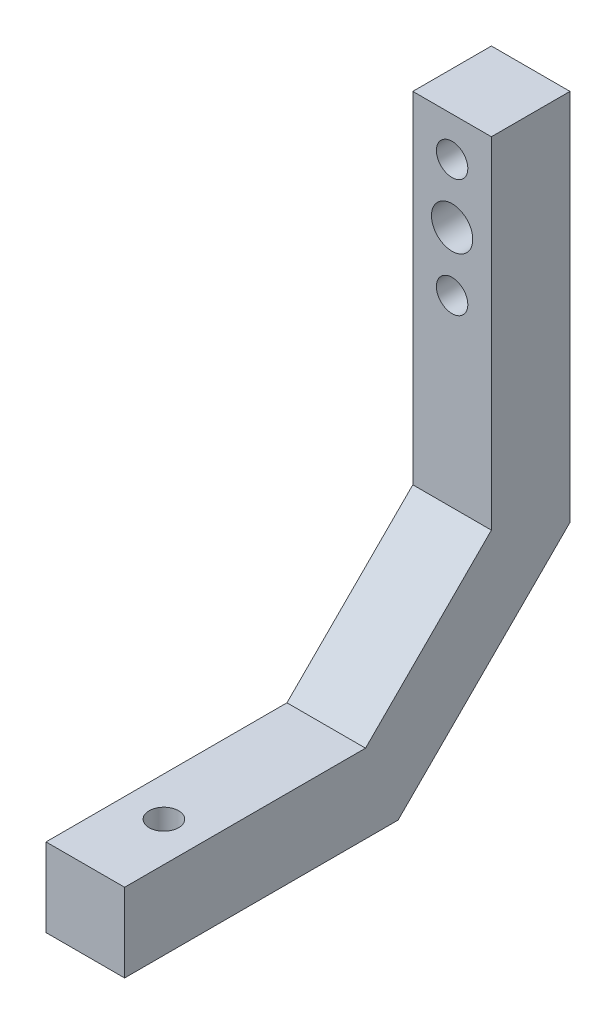
from build123d import *

# Parameters (mm, degrees)
BOSS_EXTRUDE1_DEPTH      = 4
BOSS_EXTRUDE1_DEPTH_BACK = 4
SKETCH3_R                = 1.5
CUT_EXTRUDE1_DEPTH       = 66.787275365
SKETCH4_R                = 2.1
SKETCH4_R_2              = 1.6
CUT_EXTRUDE2_DEPTH       = 59.995979524


with BuildPart() as part:
    # Sketch1 → Boss-Extrude1 (new, two sides: drawn at the far end of the back side and taken through both)
    with BuildSketch(Plane(origin=(0, 0, 0), x_dir=(0, 0, -1), z_dir=(1, 0, 0)).offset(-BOSS_EXTRUDE1_DEPTH_BACK)):
        Polygon((-8, 10), (0, 10), (0, -28), (-17.5, -45.5), (-37.34, -45.5), (-45.34, -45.5), (-45.34, -37.5), (-37.34, -37.5), (-20.813708499, -37.5), (-8, -24.686291501), align=None)
    extrude(amount=BOSS_EXTRUDE1_DEPTH + BOSS_EXTRUDE1_DEPTH_BACK)

    # Sketch3 → Cut-Extrude1 (cut, through all)
    with BuildSketch(Plane(origin=(0, -37.5, 0), x_dir=(1, 0, 0), z_dir=(0, 1, 0))):
        with Locations((0, -37.34)):
            Circle(SKETCH3_R)
    extrude(amount=-CUT_EXTRUDE1_DEPTH, mode=Mode.SUBTRACT)

    # Sketch4 → Cut-Extrude2 (cut, through all)
    with BuildSketch(Plane.XY.offset(8)):
        Circle(SKETCH4_R)
        with Locations((0, 6)):
            Circle(SKETCH4_R_2)
        with Locations((0, -6)):
            Circle(SKETCH4_R_2)
    extrude(amount=-CUT_EXTRUDE2_DEPTH, mode=Mode.SUBTRACT)


solid = part.part
